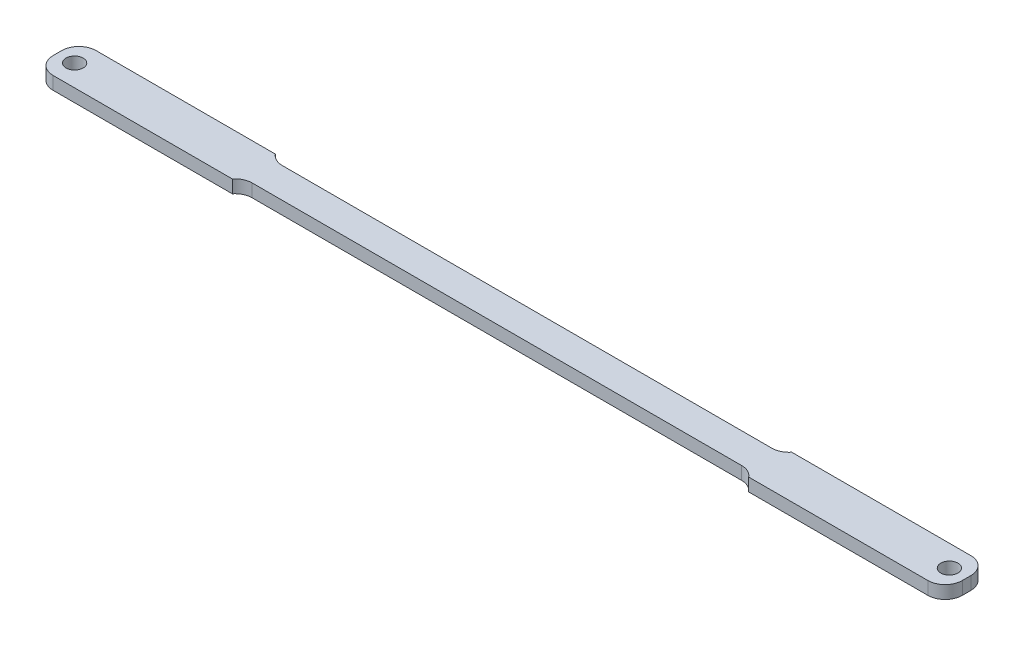
from build123d import *

# Parameters (mm, degrees)
SKETCH2_R           = 1
BOSS_EXTRUDE1_DEPTH = 1.5
SKETCH3_W           = 60
SKETCH3_H           = 1.5
CUT_EXTRUDE1_DEPTH  = 53.900400755
FILLET1_R           = 2


with BuildPart() as part:
    # Sketch2 → Boss-Extrude1 (new body)
    with BuildSketch(Plane(origin=(0, 0, 0), x_dir=(1, 0, 0), z_dir=(0, 1, 0))):
        with BuildLine():
            Line((-50.82, 2.5), (50.82, 2.5))
            ThreePointArc((50.82, 2.5), (52.234213562, 1.914213562), (52.82, 0.5))
            Line((52.82, 0.5), (52.82, -0.5))
            ThreePointArc((52.82, -0.5), (52.234213562, -1.914213562), (50.82, -2.5))
            Line((50.82, -2.5), (-50.82, -2.5))
            ThreePointArc((-50.82, -2.5), (-52.234213562, -1.914213562), (-52.82, -0.5))
            Line((-52.82, -0.5), (-52.82, 0.5))
            ThreePointArc((-52.82, 0.5), (-52.234213562, 1.914213562), (-50.82, 2.5))
        make_face()
        with Locations(Location((-50.82, 0, 0), (0, 0, 270))):
            Circle(SKETCH2_R, mode=Mode.SUBTRACT)
        with Locations(Location((50.82, 0, 0), (0, 0, 270))):
            Circle(SKETCH2_R, mode=Mode.SUBTRACT)
    extrude(amount=BOSS_EXTRUDE1_DEPTH)

    # Sketch3 → Cut-Extrude1 (cut, through all)
    with BuildSketch(Plane(origin=(0, 1.5, 0), x_dir=(1, 0, 0), z_dir=(0, 1, 0))):
        with Locations((0, 2.5)):
            Rectangle(SKETCH3_W, SKETCH3_H)
        with Locations((0, -2.5)):
            Rectangle(SKETCH3_W, SKETCH3_H)
    extrude(amount=-CUT_EXTRUDE1_DEPTH, mode=Mode.SUBTRACT)

    # Fillet1
    # the kernel refuses this fillet: 2 mm, written as the material it adds along each edge
    with BuildSketch(Plane(origin=(30, 1.5, -1.75), x_dir=(0, 0, -1), z_dir=(0, -1, 0)), Plane(origin=(-30, 1.5, 1.75), x_dir=(0, 0, 1), z_dir=(0, -1, 0))) as fillet1_piece_1:
        with BuildLine():
            CenterArc((2, -1.5612495), FILLET1_R, 128.682187453, 51.317812547)
            Line((0, -1.5612495), (-0.04, -1.5612495))
            Line((-0.04, -1.5612495), (-0.04, 0))
            Line((-0.04, 0), (0, 0.04))
            ThreePointArc((0, 0.04), (0.375, 0.04), (0.725, 0.03122499))
            Line((0.725, 0.03122499), (0.75, 0))
        make_face()
    extrude(amount=1.5)
    with BuildSketch(Plane(origin=(30, 1.5, 1.75), x_dir=(-1, 0, 0), z_dir=(0, -1, 0))) as fillet1_piece_2:
        with BuildLine():
            CenterArc((1.5612495, -2), FILLET1_R, 90, 51.317812547)
            Line((0, -0.75), (-0.03122499, -0.725))
            ThreePointArc((-0.03122499, -0.725), (-0.04, -0.375), (-0.04, 0))
            Line((-0.04, 0), (0, 0.04))
            Line((0, 0.04), (1.5612495, 0.04))
            Line((1.5612495, 0.04), (1.5612495, 0))
        make_face()
    extrude(amount=1.5)
    with BuildSketch(Plane(origin=(-30, 1.5, -1.75), x_dir=(0, 0, -1), z_dir=(0, -1, 0))) as fillet1_piece_3:
        with BuildLine():
            CenterArc((2, 1.5612495), FILLET1_R, 180, 51.317812547)
            Line((0, 1.5612495), (-0.04, 1.5612495))
            Line((-0.04, 1.5612495), (-0.04, 0))
            Line((-0.04, 0), (0, -0.04))
            ThreePointArc((0, -0.04), (0.375, -0.04), (0.725, -0.03122499))
            Line((0.725, -0.03122499), (0.75, 0))
        make_face()
    extrude(amount=1.5)


solid = part.part
